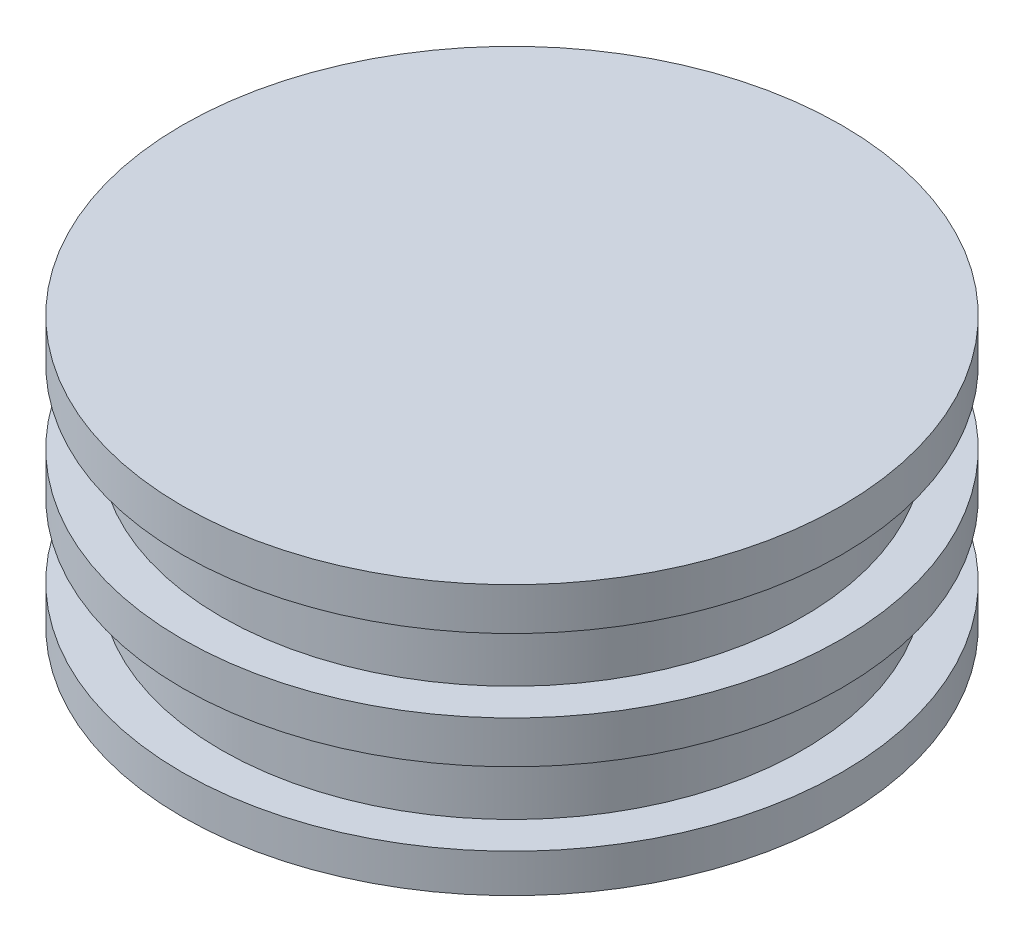
from build123d import *

# Parameters (mm, degrees)
SKETCH1_R           = 10.8839
BOSS_EXTRUDE1_DEPTH = 8.89
SKETCH4_W           = 2.413
SKETCH4_H           = 2.413
LPATTERN1_COUNT     = 2
LPATTERN1_PITCH     = 3.81


with BuildPart() as part:
    # Sketch1 → Boss-Extrude1 (new body)
    with BuildSketch(Plane(origin=(0, 0, 0), x_dir=(1, 0, 0), z_dir=(0, 1, 0))):
        Circle(SKETCH1_R)
    extrude(amount=BOSS_EXTRUDE1_DEPTH)

    # Sketch4 → Cut-Revolve1 (revolve, cut)
    with BuildSketch(Plane.XY):
        with Locations((10.8077, 2.4765)):
            Rectangle(SKETCH4_W, SKETCH4_H)
    cut_revolve1 = revolve(axis=Axis((0, 0, 0), (0, 1, 0)), mode=Mode.SUBTRACT)

    # LPattern1: Cut-Revolve1 ×2
    with Locations(*[(0, i * LPATTERN1_PITCH, 0) for i in range(1, LPATTERN1_COUNT)]):
        add(cut_revolve1, mode=Mode.SUBTRACT)


solid = part.part
